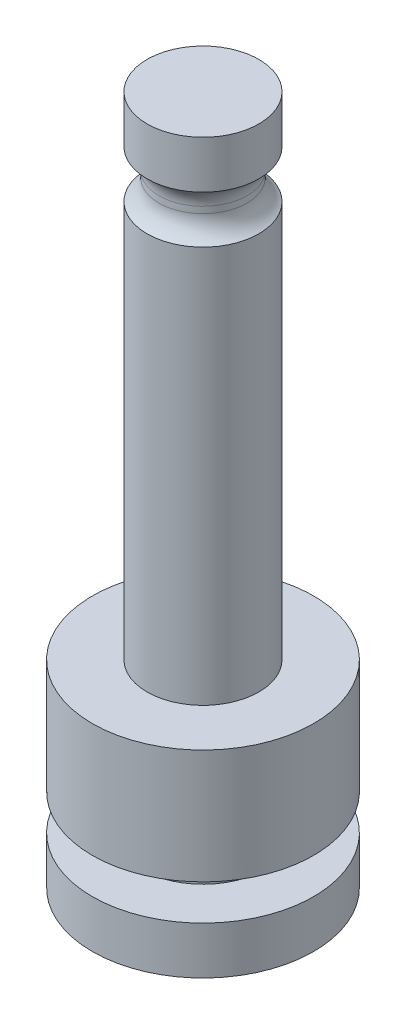
from build123d import *

# Parameters (mm, degrees)
BOSS_EXTRUDE1_DEPTH      = 4.3
BOSS_EXTRUDE1_DEPTH_BACK = 4
SKETCH1_R                = 4.65
SKETCH2_R                = 2.35
BOSS_EXTRUDE2_DEPTH      = 20.68
CUT_EXTRUDE1_START       = -4
SKETCH3_R                = 2.35
SKETCH3_R_2              = 1.85
CUT_EXTRUDE1_DEPTH       = 2
CUT_EXTRUDE2_START       = -2
SKETCH4_R                = 4.65
SKETCH4_R_2              = 2.65
CUT_EXTRUDE2_DEPTH       = 1.5
FILLET1_R                = 1


with BuildPart() as part:
    # Sketch1 → Boss-Extrude1 (new, two sides: drawn at the far end of the back side and taken through both)
    with BuildSketch(Plane(origin=(0, 0, 0), x_dir=(1, 0, 0), z_dir=(0, 1, 0)).offset(-BOSS_EXTRUDE1_DEPTH_BACK)):
        with Locations(Location((0, 0, 0), (0, 0, 270))):
            Circle(SKETCH1_R)
    extrude(amount=BOSS_EXTRUDE1_DEPTH + BOSS_EXTRUDE1_DEPTH_BACK)

    # Sketch2 → Boss-Extrude2 (add)
    with BuildSketch(Plane(origin=(0, 4.3, 0), x_dir=(1, 0, 0), z_dir=(0, 1, 0))):
        with Locations(Location((0, 0, 0), (0, 0, 270))):
            Circle(SKETCH2_R)
    extrude(amount=BOSS_EXTRUDE2_DEPTH)

    # Sketch3 → Cut-Extrude1 (cut)
    with BuildSketch(Plane(origin=(0, 24.98, 0), x_dir=(1, 0, 0), z_dir=(0, 1, 0)).offset(CUT_EXTRUDE1_START)):
        with Locations(Location((0, 0, 0), (0, 0, 270))):
            Circle(SKETCH3_R)
        with Locations(Location((0, 0, 0), (0, 0, 270))):
            Circle(SKETCH3_R_2, mode=Mode.SUBTRACT)
    extrude(amount=CUT_EXTRUDE1_DEPTH, mode=Mode.SUBTRACT)

    # Sketch4 → Cut-Extrude2 (cut)
    with BuildSketch(Plane.XZ.offset(4).offset(CUT_EXTRUDE2_START)):
        with Locations(Location((0, 0, 0), (0, 0, 90))):
            Circle(SKETCH4_R)
        with Locations(Location((0, 0, 0), (0, 0, 270))):
            Circle(SKETCH4_R_2, mode=Mode.SUBTRACT)
    extrude(amount=-CUT_EXTRUDE2_DEPTH, mode=Mode.SUBTRACT)

    # Fillet1
    # the kernel refuses this fillet: 1 mm, written as the material it adds along each edge
    with BuildSketch(Plane(origin=(0, 20.98, 0), x_dir=(0, 0, 1), z_dir=(-1, 0, 0))) as fillet1_piece_1:
        with BuildLine():
            CenterArc((2.85, 0.866025404), FILLET1_R, 180, 60)
            Line((1.85, 0.866025404), (1.83, 0.866025404))
            Line((1.83, 0.866025404), (1.83, 0))
            Line((1.83, 0), (1.85, -0.02))
            ThreePointArc((1.85, -0.02), (2.1, -0.02), (2.34, -0.017320508))
            Line((2.34, -0.017320508), (2.35, 0))
        make_face()
    revolve(axis=Axis((0, 20.98, 0), (0, 1, 0)))
    with BuildSketch(Plane(origin=(0, 22.98, 0), x_dir=(0, 0, 1), z_dir=(-1, 0, 0))) as fillet1_piece_2:
        with BuildLine():
            CenterArc((2.85, -0.866025404), FILLET1_R, 120, 60)
            Line((2.35, 0), (2.34, 0.017320508))
            ThreePointArc((2.34, 0.017320508), (2.1, 0.02), (1.85, 0.02))
            Line((1.85, 0.02), (1.83, 0))
            Line((1.83, 0), (1.83, -0.866025404))
            Line((1.83, -0.866025404), (1.85, -0.866025404))
        make_face()
    revolve(axis=Axis((0, 22.98, 0), (0, 1, 0)))


solid = part.part
